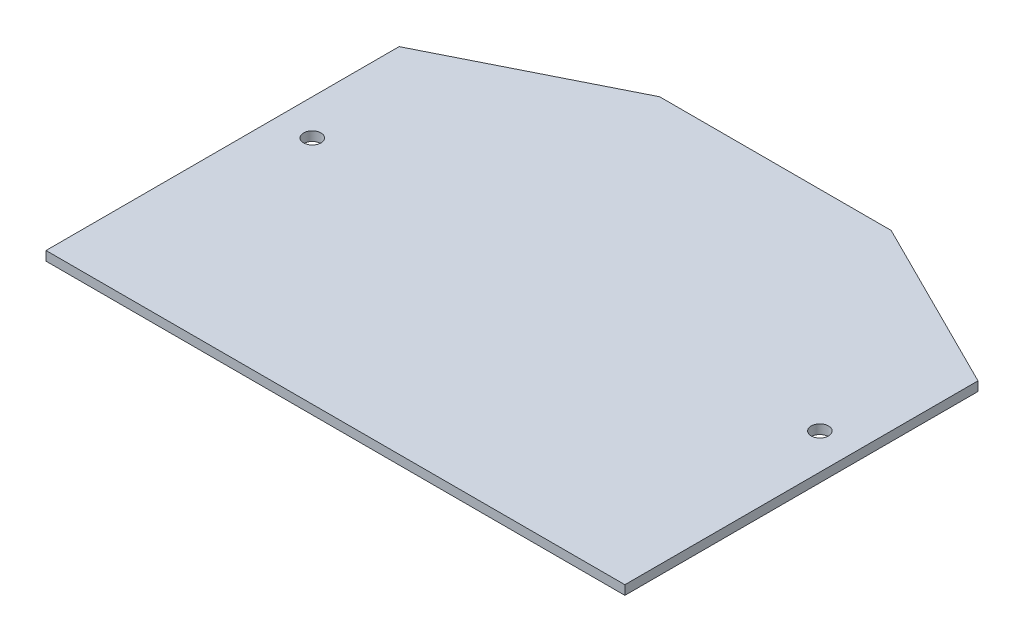
from build123d import *

# Parameters (mm, degrees)
SKETCH1_R           = 1.5
BOSS_EXTRUDE1_DEPTH = 1.6


with BuildPart() as part:
    # Sketch1 → Boss-Extrude1 (new body)
    with BuildSketch(Plane(origin=(0, 0, 0), x_dir=(1, 0, 0), z_dir=(0, 1, 0))):
        Polygon((-50, 65), (-20, 80), (0, 80), (0, 4), (-50, 4), align=None)
        with Locations((-43.840620434, 43.840620434)):
            Circle(SKETCH1_R, mode=Mode.SUBTRACT)
    boss_extrude1 = extrude(amount=BOSS_EXTRUDE1_DEPTH)

    # Mirror1: Boss-Extrude1 across plane
    add(boss_extrude1.mirror(Plane(origin=(0, 1.6, -4), x_dir=(0, 0, 1), z_dir=(-1, 0, 0))))


solid = part.part
